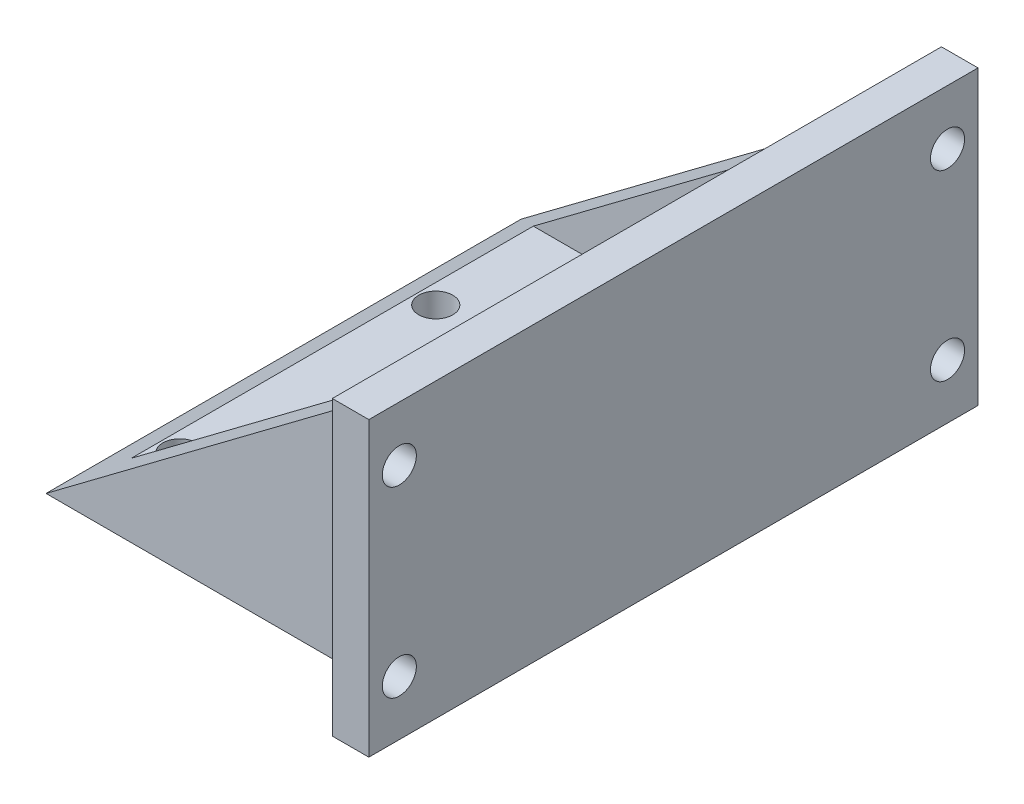
from build123d import *

# Parameters (mm, degrees)
EXTRUDE_1_DEPTH           = 39
SHELL_1_T                 = -3
SKETCH_2_R                = 1.4
CUT_EXTRUDE_1_DEPTH       = 30
SKETCH_3_R                = 6.5
CUT_EXTRUDE_2_DEPTH       = 5
SKETCH_5_W                = 50
SKETCH_5_H                = 24
EXTRUDE_2_DEPTH           = 3
SKETCH_4_R                = 1.4
CUT_EXTRUDE_3_DEPTH       = 5
FILLET_1_R                = 5
CUT_EXTRUDE_4_OUTLINE_R   = 1.4
CUT_EXTRUDE_4_OUTLINE_R_2 = 2.75
CUT_EXTRUDE_4_DEPTH       = 3.43874985


with BuildPart() as part:
    # ｽｹｯﾁ1 → ﾎﾞｽ - 押し出し1 (new body)
    with BuildSketch(Plane.XY):
        Polygon((0, 0), (32, 0), (32, 24), align=None)
    extrude(amount=EXTRUDE_1_DEPTH)

    # ｼｪﾙ1
    shell_1_openings = [part.faces().sort_by_distance(p)[0] for p in [
        (16, 12, 19.5),
    ]]
    offset(amount=SHELL_1_T, openings=shell_1_openings, kind=Kind.INTERSECTION)

    # ｽｹｯﾁ2 → ｶｯﾄ - 押し出し1 (cut)
    with BuildSketch(Plane.XZ):
        with Locations(Location((26.6, 12.609, 0), (0, 0, 270))):
            Circle(SKETCH_2_R)
        with Locations(Location((5.6, 12.609, 0), (0, 0, 270))):
            Circle(SKETCH_2_R)
        with Locations(Location((5.6, 33.609, 0), (0, 0, 270))):
            Circle(SKETCH_2_R)
        with Locations(Location((26.6, 33.609, 0), (0, 0, 270))):
            Circle(SKETCH_2_R)
    extrude(amount=-CUT_EXTRUDE_1_DEPTH, mode=Mode.SUBTRACT)

    # ｽｹｯﾁ3 → ｶｯﾄ - 押し出し2 (cut)
    with BuildSketch(Plane.XZ):
        with Locations(Location((16.1, 12.609, 0), (0, 0, 270))):
            Circle(SKETCH_3_R)
    extrude(amount=-CUT_EXTRUDE_2_DEPTH, mode=Mode.SUBTRACT)

    # ｽｹｯﾁ5 → ﾎﾞｽ - 押し出し2 (add)
    with BuildSketch(Plane(origin=(32, 0, 0), x_dir=(0, 0, -1), z_dir=(1, 0, 0))):
        with Locations((-19.5, 12)):
            Rectangle(SKETCH_5_W, SKETCH_5_H)
    extrude(amount=-EXTRUDE_2_DEPTH)

    # ｽｹｯﾁ4 → ｶｯﾄ - 押し出し3 (cut)
    with BuildSketch(Plane(origin=(32, 0, 0), x_dir=(0, 0, -1), z_dir=(1, 0, 0))):
        with Locations((3, 19.5)):
            Circle(SKETCH_4_R)
        with Locations((-42, 19.5)):
            Circle(SKETCH_4_R)
        with Locations((-42, 4.5)):
            Circle(SKETCH_4_R)
        with Locations((3, 4.5)):
            Circle(SKETCH_4_R)
    extrude(amount=-CUT_EXTRUDE_3_DEPTH, mode=Mode.SUBTRACT)

    # ﾌｨﾚｯﾄ1
    # the kernel refuses this fillet: 5 mm, written as the material it adds along each edge
    with BuildSketch(Plane(origin=(29, 34.25, 39), x_dir=(-1, 0, 0), z_dir=(0, -1, 0))) as fillet_1_piece_1_section:
        with BuildLine():
            CenterArc((FILLET_1_R, -FILLET_1_R), FILLET_1_R, 90, 90)
            Line((0, -FILLET_1_R), (0, 0))
            Line((0, 0), (FILLET_1_R, 0))
        make_face()
    fillet_1_piece_1 = extrude(amount=34.25, mode=Mode.PRIVATE)
    fillet_1_piece_1 = split(fillet_1_piece_1, bisect_by=Plane(origin=(35, 26.25, 39), z_dir=(0.6, -0.8, 0)), keep=Keep.TOP, mode=Mode.PRIVATE)
    fillet_1_piece_1 = fillet_1_piece_1 - Plane(origin=(29, 4.5, 42), x_dir=(0, 0, -1), z_dir=(1, 0, 0)) * Cylinder(1.4, 89, mode=Mode.PRIVATE)
    fillet_1_piece_1 = fillet_1_piece_1 - Plane(origin=(29, 19.5, 42), x_dir=(0, 0, -1), z_dir=(1, 0, 0)) * Cylinder(1.4, 89, mode=Mode.PRIVATE)
    add(fillet_1_piece_1)
    with BuildSketch(Plane(origin=(29, 34.25, 0), x_dir=(-1, 0, 0), z_dir=(0, -1, 0))) as fillet_1_piece_2_section:
        with BuildLine():
            CenterArc((FILLET_1_R, FILLET_1_R), FILLET_1_R, 180, 90)
            Line((0, FILLET_1_R), (0, 0))
            Line((0, 0), (FILLET_1_R, 0))
        make_face()
    fillet_1_piece_2 = extrude(amount=34.25, mode=Mode.PRIVATE)
    fillet_1_piece_2 = split(fillet_1_piece_2, bisect_by=Plane(origin=(35, 26.25, 0), z_dir=(0.6, -0.8, 0)), keep=Keep.TOP, mode=Mode.PRIVATE)
    fillet_1_piece_2 = fillet_1_piece_2 - Plane(origin=(29, 4.5, -3), x_dir=(0, 0, -1), z_dir=(1, 0, 0)) * Cylinder(1.4, 89, mode=Mode.PRIVATE)
    fillet_1_piece_2 = fillet_1_piece_2 - Plane(origin=(29, 19.5, -3), x_dir=(0, 0, -1), z_dir=(1, 0, 0)) * Cylinder(1.4, 89, mode=Mode.PRIVATE)
    add(fillet_1_piece_2)

    # ｶｯﾄ - 押し出し4: read off the stored shape, not the designer's step
    # ｶｯﾄ - 押し出し4 outline → ｶｯﾄ - 押し出し4 (cut)
    # profile 1 of 4: a face of its own
    with BuildSketch(Plane.ZY.offset(-29)):
        with BuildLine():
            ThreePointArc((44, 17.612541391), (44.75, 19.5), (44, 21.387458609))
            ThreePointArc((44, 21.387458609), (43.799721616, 21.579303274), (43.58113883, 21.75))
            ThreePointArc((43.58113883, 21.75), (42, 22.25), (40.41886117, 21.75))
            ThreePointArc((40.41886117, 21.75), (39.920696726, 17.700278384), (44, 17.612541391))
        make_face()
        with Locations((42, 19.5)):
            Circle(CUT_EXTRUDE_4_OUTLINE_R, mode=Mode.SUBTRACT)
    # profile 2 of 4: a face of its own
    with BuildSketch(Plane.ZY.offset(-29)):
        with BuildLine():
            ThreePointArc((44, 2.612541391), (44.75, 4.5), (44, 6.387458609))
            ThreePointArc((44, 6.387458609), (39.25, 4.5), (44, 2.612541391))
        make_face()
        with Locations((42, 4.5)):
            Circle(CUT_EXTRUDE_4_OUTLINE_R, mode=Mode.SUBTRACT)
    # profile 3 of 4: a face of its own
    with BuildSketch(Plane.ZY.offset(-29)):
        with BuildLine():
            ThreePointArc((-5, 21.387458609), (-1.200278384, 17.420696726), (-4.58113883, 21.75))
            ThreePointArc((-4.58113883, 21.75), (-4.799721616, 21.579303274), (-5, 21.387458609))
        make_face()
        with Locations((-3, 19.5)):
            Circle(CUT_EXTRUDE_4_OUTLINE_R, mode=Mode.SUBTRACT)
    # profile 4 of 4: a face of its own
    with BuildSketch(Plane.ZY.offset(-29)):
        with Locations((-3, 4.5)):
            Circle(CUT_EXTRUDE_4_OUTLINE_R_2)
        with Locations((-3, 4.5)):
            Circle(CUT_EXTRUDE_4_OUTLINE_R, mode=Mode.SUBTRACT)
    extrude(amount=CUT_EXTRUDE_4_DEPTH, mode=Mode.SUBTRACT)


solid = part.part
